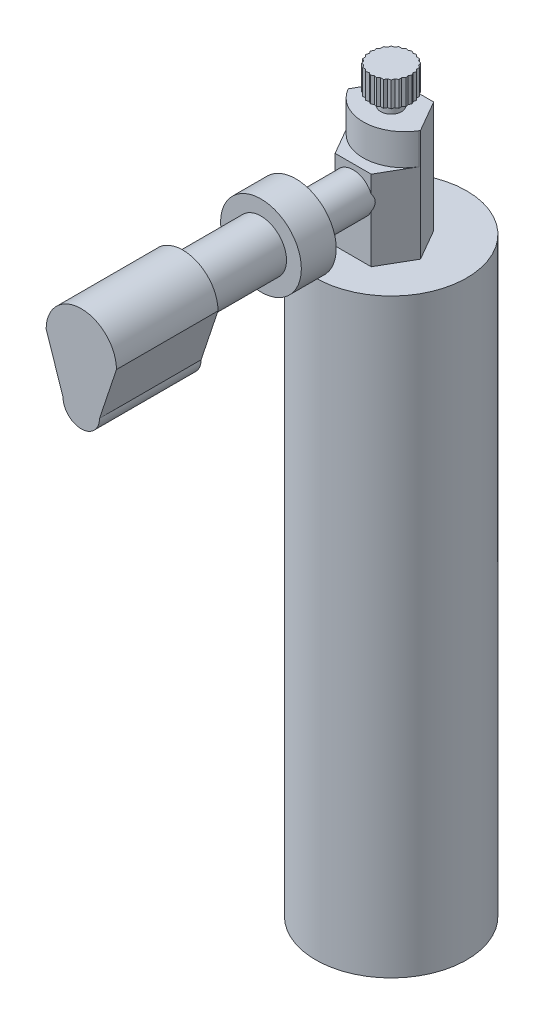
from build123d import *

# Parameters (mm, degrees)
SKETCH1_R                = 14.5
BOSS_EXTRUDE1_DEPTH      = 113.4
SKETCH2_R                = 2
BOSS_EXTRUDE2_DEPTH      = 28.5
SKETCH3_R                = 4
BOSS_EXTRUDE3_DEPTH      = 4.8
BOSS_EXTRUDE4_DEPTH      = 21.4
CUT_EXTRUDE1_DEPTH       = 6
BOSS_EXTRUDE5_DEPTH      = 11
BOSS_EXTRUDE5_DEPTH_BACK = 2
SKETCH7_R                = 3.75
SKETCH8_R                = 7.75
BOSS_EXTRUDE6_DEPTH      = 6.7
SKETCH9_R                = 4.9
BOSS_EXTRUDE7_DEPTH      = 15
BOSS_EXTRUDE8_DEPTH      = 19.5
SKETCH13_OUTSIDE_W       = 63.528
SKETCH13_OUTSIDE_H       = 108.528
CUT_EXTRUDE3_DEPTH       = 6


with BuildPart() as part:
    # Sketch1 → Boss-Extrude1 (new body)
    with BuildSketch(Plane(origin=(0, 0, 0), x_dir=(1, 0, 0), z_dir=(0, 1, 0))):
        Circle(SKETCH1_R)
    extrude(amount=BOSS_EXTRUDE1_DEPTH)

    # Sketch2 → Boss-Extrude2 (add)
    with BuildSketch(Plane(origin=(0, 113.4, 0), x_dir=(1, 0, 0), z_dir=(0, 1, 0))):
        Circle(SKETCH2_R)
    extrude(amount=BOSS_EXTRUDE2_DEPTH)

    # Sketch3 → Boss-Extrude3 (add)
    with BuildSketch(Plane(origin=(0, 141.9, 0), x_dir=(1, 0, 0), z_dir=(0, 1, 0))):
        Circle(SKETCH3_R)
    extrude(amount=-BOSS_EXTRUDE3_DEPTH)

    # Sketch4 → Boss-Extrude4 (add)
    with BuildSketch(Plane(origin=(0, 113.4, 0), x_dir=(1, 0, 0), z_dir=(0, 1, 0))):
        Polygon((3.464101615, 4.7), (-3.464101615, 4.7), (-6.92820323, -1.3), (-3.464101615, -7.3), (3.464101615, -7.3), (6.92820323, -1.3), align=None)
    extrude(amount=BOSS_EXTRUDE4_DEPTH)

    # Sketch6 → Cut-Extrude1 (cut)
    with BuildSketch(Plane(origin=(0, 134.8, 0), x_dir=(1, 0, 0), z_dir=(0, 1, 0))):
        with BuildLine():
            Line((-6.92820323, -1.3), (-6.92820323, -9.46576474))
            Line((-6.92820323, -9.46576474), (6.92820323, -9.46576474))
            Line((6.92820323, -9.46576474), (6.92820323, -1.3))
            ThreePointArc((6.92820323, -1.3), (0, -5.37), (-6.92820323, -1.3))
        make_face()
    extrude(amount=-CUT_EXTRUDE1_DEPTH, mode=Mode.SUBTRACT)

    # Sketch7 → Boss-Extrude5 (add, two sides: drawn at the far end of the back side and taken through both)
    with BuildSketch(Plane.XY.offset(7.3).offset(-BOSS_EXTRUDE5_DEPTH_BACK)):
        with Locations((0, 124.05)):
            Circle(SKETCH7_R)
    extrude(amount=BOSS_EXTRUDE5_DEPTH + BOSS_EXTRUDE5_DEPTH_BACK)

    # Sketch8 → Boss-Extrude6 (add)
    with BuildSketch(Plane.XY.offset(18.3)):
        with Locations((0, 124.05)):
            Circle(SKETCH8_R)
    extrude(amount=BOSS_EXTRUDE6_DEPTH)

    # Sketch9 → Boss-Extrude7 (add)
    with BuildSketch(Plane.XY.offset(25)):
        with Locations((0, 124.05)):
            Circle(SKETCH9_R)
    extrude(amount=BOSS_EXTRUDE7_DEPTH)

    # Sketch10 → Boss-Extrude8 (add)
    with BuildSketch(Plane.XY.offset(40)):
        with BuildLine():
            Line((-6.75, 124.05), (-3.5, 114.3))
            ThreePointArc((-3.5, 114.3), (0, 110.8), (3.5, 114.3))
            Line((3.5, 114.3), (6.75, 124.05))
            ThreePointArc((6.75, 124.05), (0, 130.8), (-6.75, 124.05))
        make_face()
    extrude(amount=BOSS_EXTRUDE8_DEPTH)

    # Sketch13 outside → Cut-Extrude3 (cut)
    with BuildSketch(Plane(origin=(0, 141.9, 0), x_dir=(1, 0, 0), z_dir=(0, 1, 0))):
        with Locations((0, -22.5)):
            Rectangle(SKETCH13_OUTSIDE_W, SKETCH13_OUTSIDE_H)
        Polygon((1.03527618, 3.863703305), (1.435062871, 3.464548247), (2, 3.464101615), (2.282855359, 2.975075026), (2.828427125, 2.828427125), (2.975075026, 2.282855359), (3.464101615, 2), (3.464548247, 1.435062871), (3.863703305, 1.03527618), (3.71791823, 0.489473221), (4, 0), (3.71791823, -0.489473221), (3.863703305, -1.03527618), (3.464548247, -1.435062871), (3.464101615, -2), (2.975075026, -2.282855359), (2.828427125, -2.828427125), (2.282855359, -2.975075026), (2, -3.464101615), (1.435062871, -3.464548247), (1.03527618, -3.863703305), (0.489473221, -3.71791823), (0, -4), (-0.489473221, -3.71791823), (-1.03527618, -3.863703305), (-1.435062871, -3.464548247), (-2, -3.464101615), (-2.282855359, -2.975075026), (-2.828427125, -2.828427125), (-2.975075026, -2.282855359), (-3.464101615, -2), (-3.464548247, -1.435062871), (-3.863703305, -1.03527618), (-3.71791823, -0.489473221), (-4, 0), (-3.71791823, 0.489473221), (-3.863703305, 1.03527618), (-3.464548247, 1.435062871), (-3.464101615, 2), (-2.975075026, 2.282855359), (-2.828427125, 2.828427125), (-2.282855359, 2.975075026), (-2, 3.464101615), (-1.435062871, 3.464548247), (-1.03527618, 3.863703305), (-0.489473221, 3.71791823), (0, 4), (0.489473221, 3.71791823), align=None, mode=Mode.SUBTRACT)
    extrude(amount=-CUT_EXTRUDE3_DEPTH, mode=Mode.SUBTRACT)


solid = part.part
